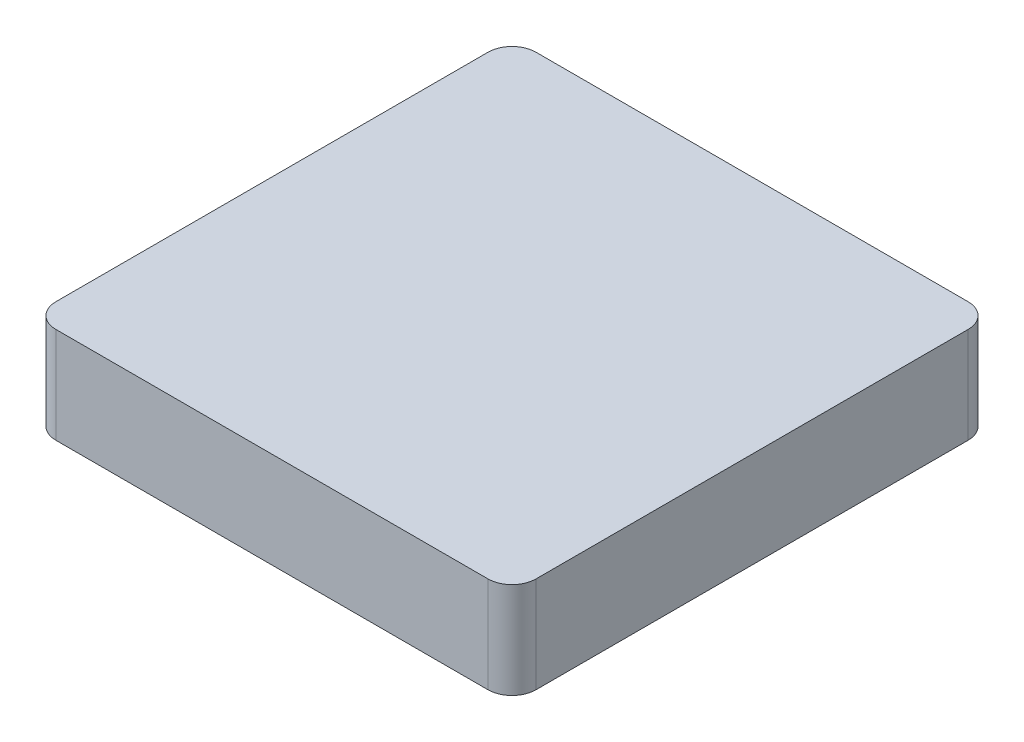
from build123d import *

# Parameters (mm, degrees)
SKETCH1_W           = 12.7
SKETCH1_H           = 12.7
BOSS_EXTRUDE1_DEPTH = 2.54
FILLET1_R           = 0.635
SHELL1_START        = 0.635
SHELL1_OUTLINE_W    = 1.905
SHELL1_OUTLINE_H    = 11.43
SHELL1_DEPTH        = 11.43
SKETCH2_R           = 2.54
BOSS_EXTRUDE2_DEPTH = 1.905


# Read off the part's stored shape, not the designer's step: Shell1
with BuildPart() as part:
    # Sketch1 → Boss-Extrude1 (new body)
    with BuildSketch(Plane(origin=(0, 0, 0), x_dir=(1, 0, 0), z_dir=(0, 1, 0))):
        with Locations((6.35, 6.35)):
            Rectangle(SKETCH1_W, SKETCH1_H)
    extrude(amount=BOSS_EXTRUDE1_DEPTH)

    # Fillet1
    fillet1_edges = [part.edges().sort_by_distance(p)[0] for p in [
        (0, 1.27, -12.7),
        (12.7, 1.27, -12.7),
        (12.7, 1.27, 0),
        (0, 1.27, 0),
    ]]
    fillet(fillet1_edges, radius=FILLET1_R)

    # Shell1 outline → Shell1 (cut)
    with BuildSketch(Plane.YZ.offset(SHELL1_START)):
        with Locations((0.9525, -6.35)):
            Rectangle(SHELL1_OUTLINE_W, SHELL1_OUTLINE_H)
    extrude(amount=SHELL1_DEPTH, mode=Mode.SUBTRACT)

    # Sketch2 → Boss-Extrude2 (add)
    with BuildSketch(Plane(origin=(0, 1.905, 0), x_dir=(-1, 0, 0), z_dir=(0, -1, 0))):
        with Locations(Location((-6.35, 6.35, 0), (0, 0, 270))):
            Circle(SKETCH2_R)
    extrude(amount=BOSS_EXTRUDE2_DEPTH)


solid = part.part
